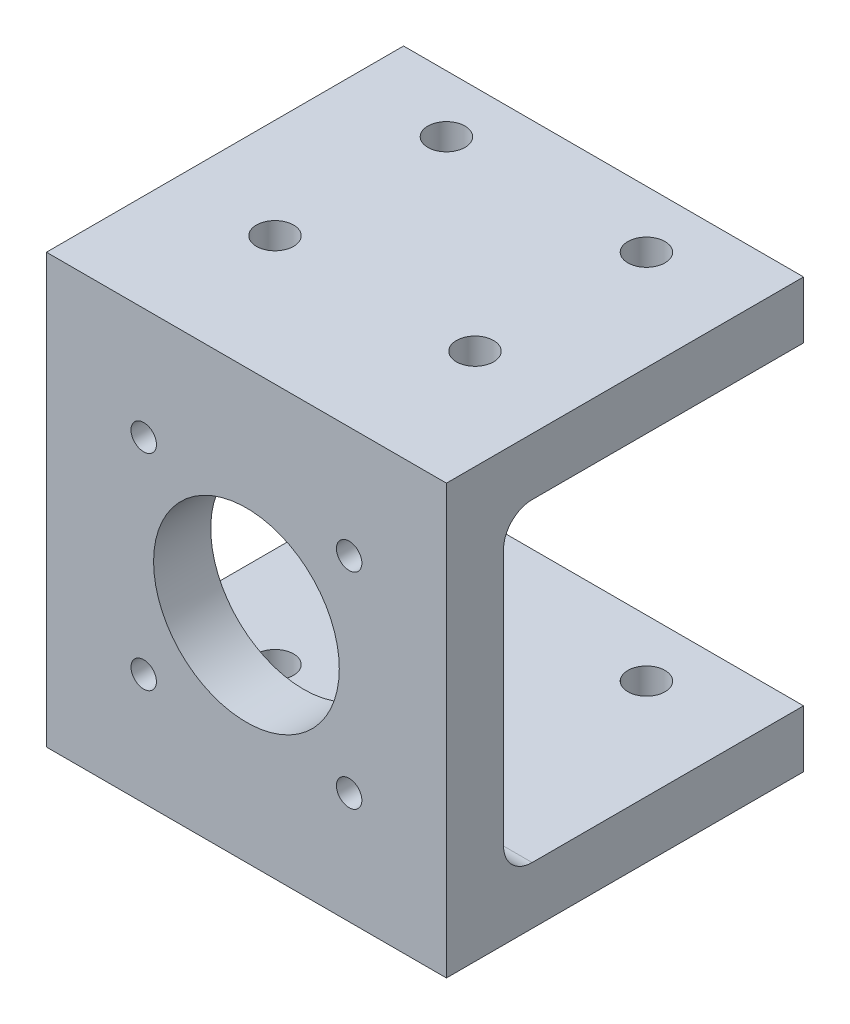
from build123d import *

# Parameters (mm, degrees)
SKETCH1_W                                    = 35.56
SKETCH1_H                                    = 38.1
SKETCH1_R                                    = 8.255
SKETCH1_R_2                                  = 1.1303
BOSS_EXTRUDE_WITH_4_40_TAP_DRILL_HOLES_DEPTH = 15.875
CUT_EXTRUDE1_REACH                           = 45.352
SKETCH3_W                                    = 26.67
SKETCH3_H                                    = 27.94
FILLET1_R                                    = 2.54
SKETCH5_R                                    = 1.65
CLEARANCE_HOLES_FOR_M3_SCREW_DEPTH           = 45.941673589


with BuildPart() as part:
    # Sketch1 → Boss-Extrude with 4-40 Tap Drill Holes (new, symmetric)
    with BuildSketch(Plane.XY):
        Rectangle(SKETCH1_W, SKETCH1_H)
        Circle(SKETCH1_R, mode=Mode.SUBTRACT)
        with Locations((-9.1313, 9.1313)):
            Circle(SKETCH1_R_2, mode=Mode.SUBTRACT)
        with Locations((9.1313, 9.1313)):
            Circle(SKETCH1_R_2, mode=Mode.SUBTRACT)
        with Locations((-9.1313, -9.1313)):
            Circle(SKETCH1_R_2, mode=Mode.SUBTRACT)
        with Locations((9.1313, -9.1313)):
            Circle(SKETCH1_R_2, mode=Mode.SUBTRACT)
    extrude(amount=BOSS_EXTRUDE_WITH_4_40_TAP_DRILL_HOLES_DEPTH, both=True)

    # Sketch3 → Cut-Extrude1 (cut, up to next)
    with BuildSketch(Plane(origin=(17.78, 0, 0), x_dir=(0, 0, -1), z_dir=(1, 0, 0)), mode=Mode.PRIVATE) as cut_extrude1_sk1:
        with Locations((2.54, 0)):
            Rectangle(SKETCH3_W, SKETCH3_H)
    cut_extrude1_tool1 = extrude(cut_extrude1_sk1.sketch, amount=-CUT_EXTRUDE1_REACH, mode=Mode.PRIVATE) & part.part
    add(cut_extrude1_tool1.solids().sort_by_distance((17.78, 0, -2.54))[0], mode=Mode.SUBTRACT)

    # Fillet1
    fillet1_edges = [part.edges().sort_by_distance(p)[0] for p in [
        (0, -13.97, 10.795),
        (0, 13.97, 10.795),
    ]]
    fillet(fillet1_edges, radius=FILLET1_R)

    # Sketch5 → Clearance Holes for M3 Screw (cut, through all)
    with BuildSketch(Plane(origin=(0, 19.05, 0), x_dir=(1, 0, 0), z_dir=(0, 1, 0))):
        with Locations((-8.89, 10.795)):
            Circle(SKETCH5_R)
        with Locations((8.89, 10.795)):
            Circle(SKETCH5_R)
        with Locations((8.89, -4.445)):
            Circle(SKETCH5_R)
        with Locations((-8.89, -4.445)):
            Circle(SKETCH5_R)
    extrude(amount=-CLEARANCE_HOLES_FOR_M3_SCREW_DEPTH, mode=Mode.SUBTRACT)


solid = part.part
